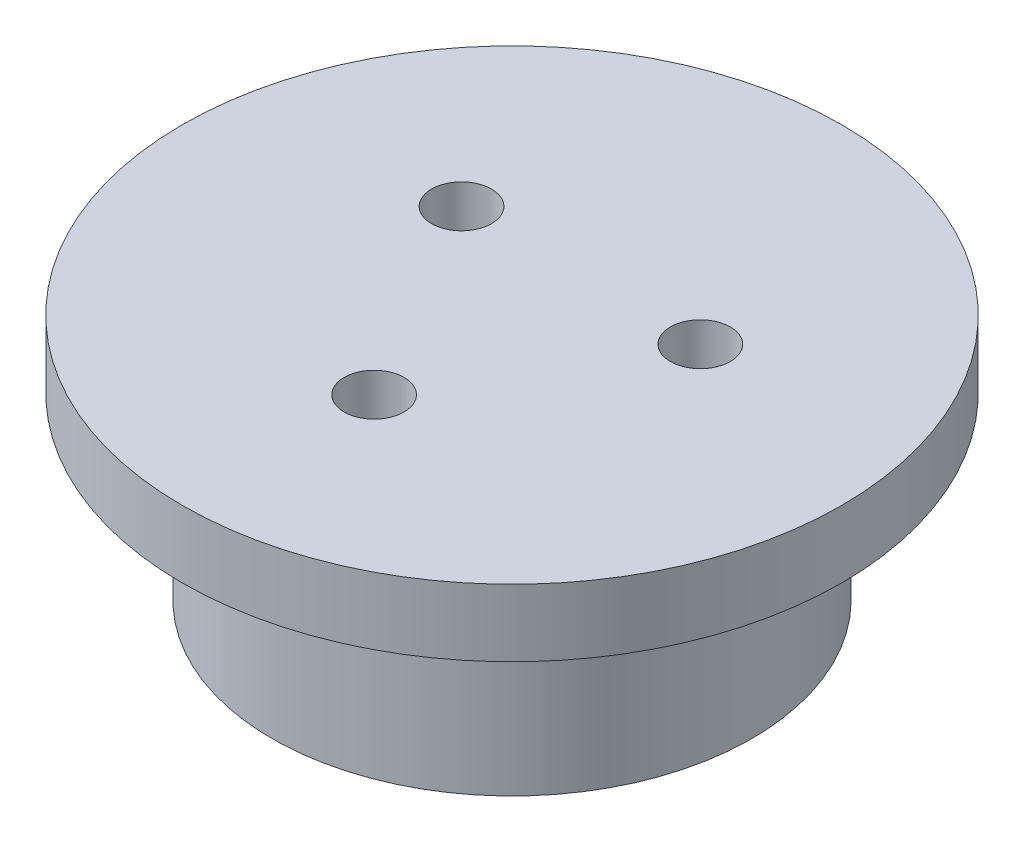
from build123d import *

# Parameters (mm, degrees)
SKETCH1_R           = 27.5
SKETCH1_R_2         = 2.5
BOSS_EXTRUDE1_DEPTH = 5.6
BOSS_EXTRUDE2_START = 15
SKETCH2_R           = 20
SKETCH2_R_2         = 2.5
BOSS_EXTRUDE2_DEPTH = 15
SKETCH3_R           = 17.5
CUT_EXTRUDE1_DEPTH  = 5


with BuildPart() as part:
    # Sketch1 → Boss-Extrude1 (new body)
    with BuildSketch(Plane(origin=(0, 0, 0), x_dir=(1, 0, 0), z_dir=(0, 1, 0))):
        Circle(SKETCH1_R)
        with Locations((-9.959292144, 5.75)):
            Circle(SKETCH1_R_2, mode=Mode.SUBTRACT)
        with Locations((9.959292144, 5.75)):
            Circle(SKETCH1_R_2, mode=Mode.SUBTRACT)
        with Locations((0, -11.5)):
            Circle(SKETCH1_R_2, mode=Mode.SUBTRACT)
    extrude(amount=BOSS_EXTRUDE1_DEPTH)

    # Sketch2 → Boss-Extrude2 (add)
    with BuildSketch(Plane.XZ.offset(BOSS_EXTRUDE2_START)):
        Circle(SKETCH2_R)
        with Locations((0, 11.5)):
            Circle(SKETCH2_R_2, mode=Mode.SUBTRACT)
        with Locations((9.959292144, -5.75)):
            Circle(SKETCH2_R_2, mode=Mode.SUBTRACT)
        with Locations((-9.959292144, -5.75)):
            Circle(SKETCH2_R_2, mode=Mode.SUBTRACT)
    extrude(amount=-BOSS_EXTRUDE2_DEPTH)

    # Sketch3 → Cut-Extrude1 (cut)
    with BuildSketch(Plane.XZ.offset(15)):
        Circle(SKETCH3_R)
    extrude(amount=-CUT_EXTRUDE1_DEPTH, mode=Mode.SUBTRACT)


solid = part.part
